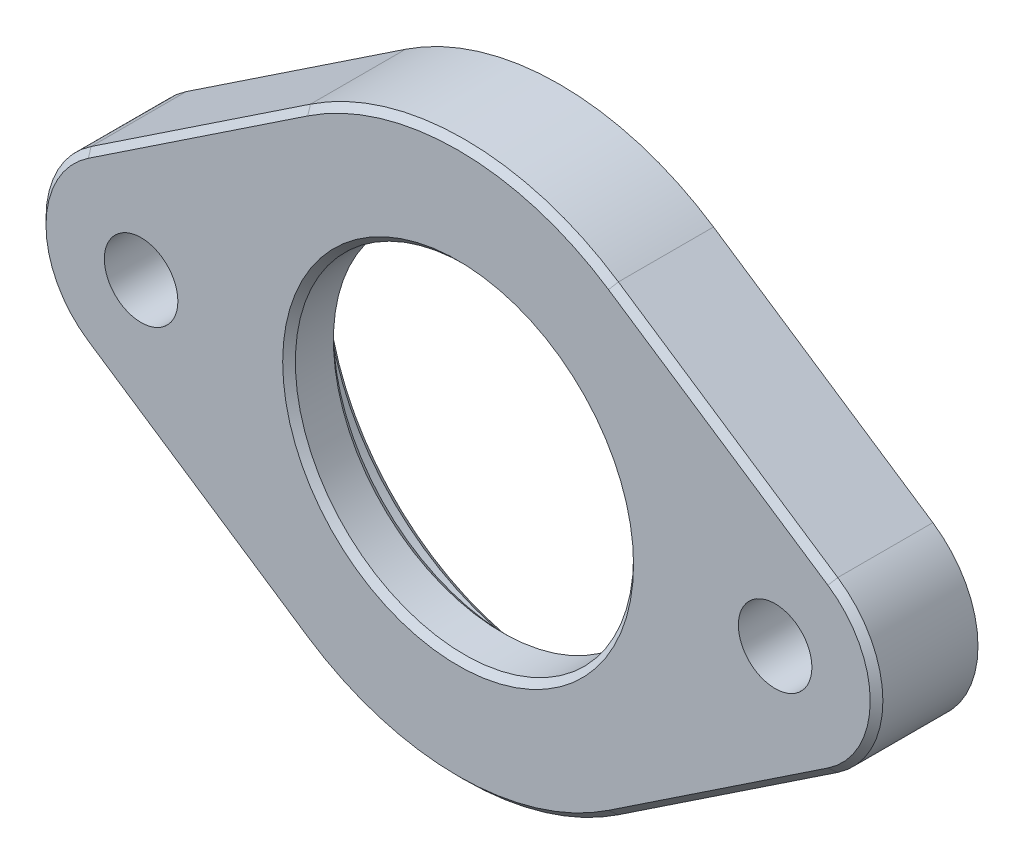
from build123d import *

# Parameters (mm, degrees)
BOSS_EXTRUDE1_DEPTH     = 4
CUT_EXTRUDE1_DEPTH      = 21.196012137
CUT_EXTRUDE1_DEPTH_BACK = 21.196012137
SKETCH1_4_R             = 6.6675
CUT_EXTRUDE2_DEPTH      = 2
CUT_EXTRUDE2_DEPTH_BACK = 21.196012137
SKETCH1_6_R             = 8.9375
M2_5_CLEARANCE_HOLE1_D  = 2.9
CHAMFER1_SIZE           = 0.25


with BuildPart() as part:
    # Sketch1 → Boss-Extrude1 (new body)
    with BuildSketch(Plane.XY):
        with BuildLine():
            ThreePointArc((6.0703125, 9.098363172), (0, 10.9375), (-6.0703125, 9.098363172))
            Line((-6.0703125, 9.098363172), (-14.72, 3.327401388))
            ThreePointArc((-14.72, 3.327401388), (-16.5, 0), (-14.72, -3.327401388))
            Line((-14.72, -3.327401388), (-6.0703125, -9.098363172))
            ThreePointArc((-6.0703125, -9.098363172), (0, -10.9375), (6.0703125, -9.098363172))
            Line((6.0703125, -9.098363172), (14.72, -3.327401388))
            ThreePointArc((14.72, -3.327401388), (16.5, 0), (14.72, 3.327401388))
            Line((14.72, 3.327401388), (6.0703125, 9.098363172))
        make_face()
    extrude(amount=BOSS_EXTRUDE1_DEPTH)

    # Sketch1<4> → Cut-Extrude1 (cut, two sides: drawn at the far end of the back side and taken through both)
    with BuildSketch(Plane.XY.offset(-CUT_EXTRUDE1_DEPTH_BACK)):
        Circle(SKETCH1_4_R)
    extrude(amount=CUT_EXTRUDE1_DEPTH + CUT_EXTRUDE1_DEPTH_BACK, mode=Mode.SUBTRACT)

    # Sketch1<6> → Cut-Extrude2 (cut, two sides: drawn at the far end of the back side and taken through both)
    with BuildSketch(Plane.XY.offset(-CUT_EXTRUDE2_DEPTH_BACK)):
        Circle(SKETCH1_6_R)
    extrude(amount=CUT_EXTRUDE2_DEPTH + CUT_EXTRUDE2_DEPTH_BACK, mode=Mode.SUBTRACT)

    # M2.5 Clearance Hole1 (through all)
    with Locations(Plane.XY.offset(4)):
        with Locations((-12.5, 0), (12.5, 0)):
            Hole(M2_5_CLEARANCE_HOLE1_D / 2)

    # Chamfer1
    chamfer1_edges = [part.edges().sort_by_distance(p)[0] for p in [
        (-6.6675, 0, 4),
        (-6.6675, 0, 2),
        (-8.9375, 0, 0),
        (-8.9375, 0, 2),
        (10.39515625, -6.21288228, 4),
        (16.5, 0, 4),
        (0, -10.9375, 4),
        (10.39515625, 6.21288228, 4),
        (-10.39515625, -6.21288228, 4),
        (0, 10.9375, 4),
        (-16.5, 0, 4),
        (-10.39515625, 6.21288228, 4),
    ]]
    chamfer(chamfer1_edges, length=CHAMFER1_SIZE)


solid = part.part
